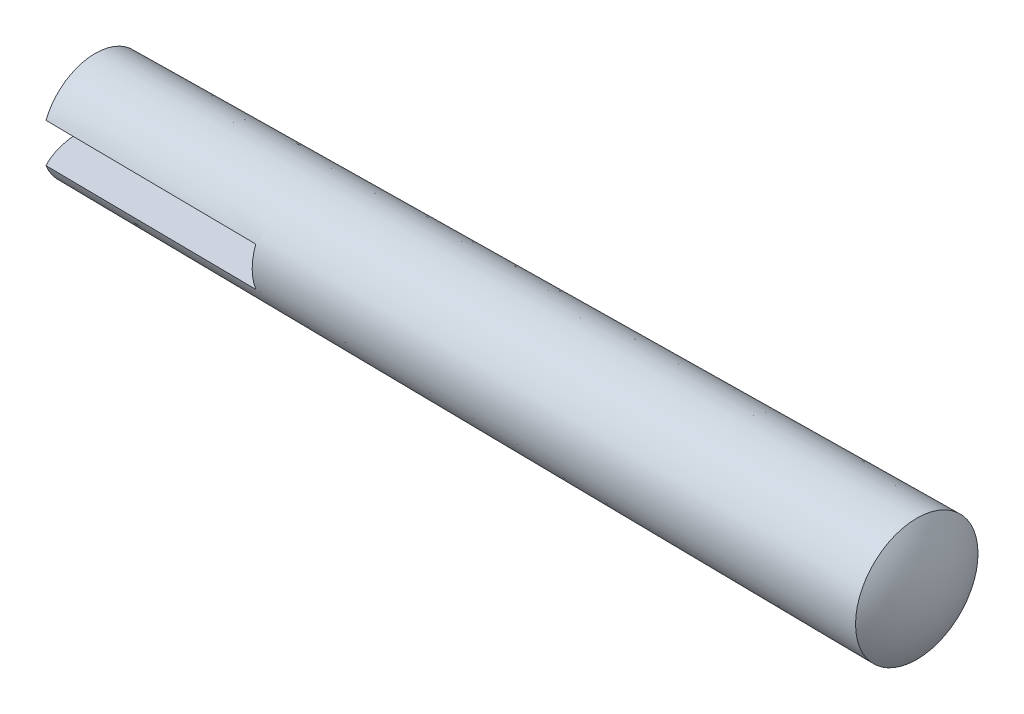
from build123d import *

# Parameters (mm, degrees)
SPLIT_2_DEPTH      = 10
SPLIT_2_DEPTH_BACK = 40.867646096
SPLSKE_W           = 5.7748
SPLSKE_H           = 1.850215418


with BuildPart() as part:
    # BodySke → Body (revolve)
    with BuildSketch(Plane.XY):
        with BuildLine():
            Line((0, 2.5), (38.74, 2.8874))
            ThreePointArc((38.74, 2.8874), (39.422958568, 1.514905806), (39.65797584, 0))
            Line((39.65797584, 0), (-0.669872981, 0))
            ThreePointArc((-0.669872981, 0), (-0.499502113, 1.294095226), (0, 2.5))
        make_face()
    revolve(axis=Axis((-0.669872981, 0, 0), (1, 0, 0)))

    # SplSke → Split 2 (cut, two sides: drawn at the far end of the back side and taken through both)
    with BuildSketch(Plane(origin=(0, 0, 0), x_dir=(0, 0, -1), z_dir=(1, 0, 0)).offset(-SPLIT_2_DEPTH_BACK)):
        Rectangle(SPLSKE_W, SPLSKE_H)
    extrude(amount=SPLIT_2_DEPTH + SPLIT_2_DEPTH_BACK, mode=Mode.SUBTRACT)


solid = part.part
